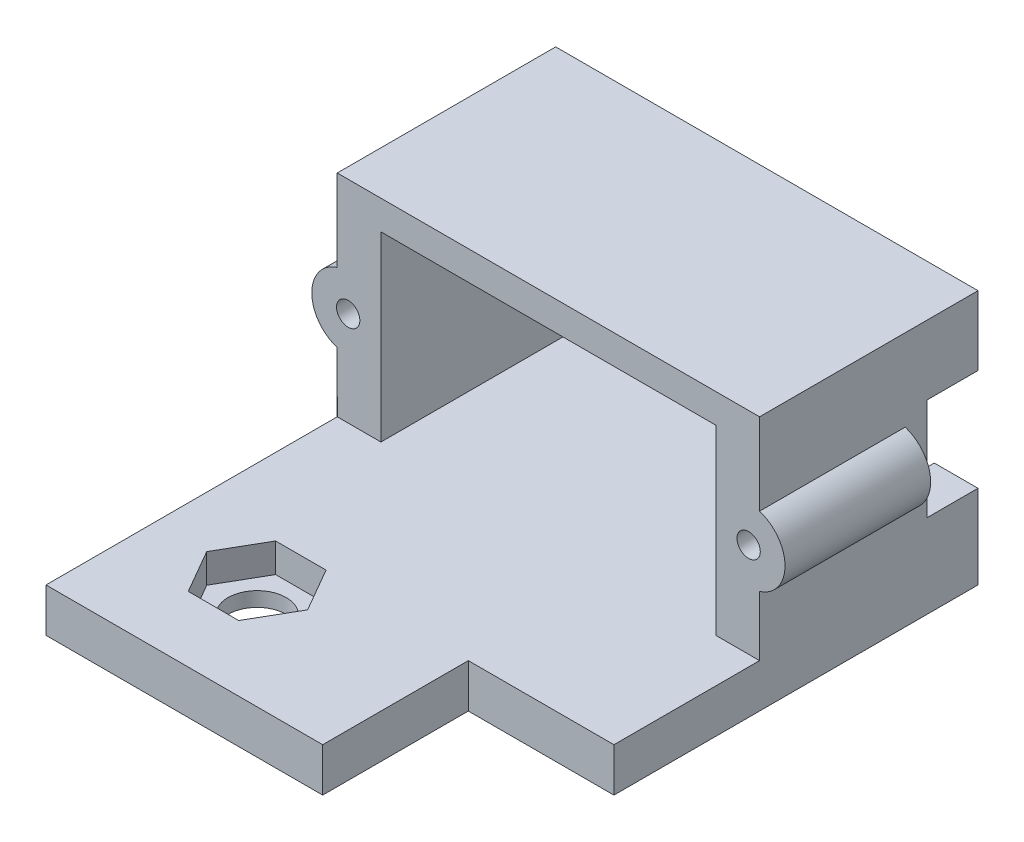
from build123d import *

# Parameters (mm, degrees)
SKETCH1_W                           = 23
SKETCH1_H                           = 15
BOSS_EXTRUDE1_DEPTH                 = 3
BOSS_EXTRUDE2_DEPTH                 = 12.5
BOSS_EXTRUDE2_DEPTH_BACK            = 3
SKETCH2_W                           = 3
SKETCH2_H                           = 15
BOSS_EXTRUDE3_DEPTH                 = 10
TAP_START                           = -2.5
TAP_DRILL_FOR_M2X0_4_TAP1_OUTLINE_R = 0.8
TAP_DRILL_FOR_M2X0_4_TAP1_DEPTH     = 10
SKETCH6_W                           = 29
SKETCH6_H                           = 20
BOSS_EXTRUDE4_DEPTH                 = 3
SKETCH7_W                           = 10
SKETCH7_H                           = 10
CUT_EXTRUDE1_DEPTH                  = 35.301056835
CUT_EXTRUDE2_DEPTH                  = 2
F_4_0_4_DIAMETER_HOLE1_D            = 4
F_4_0_4_DIAMETER_HOLE1_DEPTH        = 10
F_4_0_4_DIAMETER_HOLE1_TIP          = 1.201721238
SKETCH12_W                          = 29
SKETCH12_H                          = 15
BOSS_EXTRUDE5_DEPTH                 = 2
SKETCH13_W                          = 3
SKETCH13_H                          = 7
CUT_EXTRUDE4_DEPTH                  = 3.5


# Read off the part's stored shape, not the designer's step: Tap Drill for M2x0.4 Tap1
with BuildPart() as part:
    # Sketch1 → Boss-Extrude1 (new body)
    with BuildSketch(Plane(origin=(0, 0, 0), x_dir=(1, 0, 0), z_dir=(0, 1, 0))):
        Rectangle(SKETCH1_W, SKETCH1_H)
    extrude(amount=BOSS_EXTRUDE1_DEPTH)

    # Sketch2 → Boss-Extrude2 (add, two sides: drawn at the far end of the back side and taken through both)
    with BuildSketch(Plane(origin=(0, 3, 0), x_dir=(1, 0, 0), z_dir=(0, 1, 0)).offset(-BOSS_EXTRUDE2_DEPTH_BACK)):
        with Locations((13, 0)):
            Rectangle(SKETCH2_W, SKETCH2_H)
        with Locations((-13, 0)):
            Rectangle(SKETCH2_W, SKETCH2_H)
    extrude(amount=BOSS_EXTRUDE2_DEPTH + BOSS_EXTRUDE2_DEPTH_BACK)

    # Sketch3 → Boss-Extrude3 (add)
    with BuildSketch(Plane.XY.offset(7.5)):
        with BuildLine():
            ThreePointArc((16.25, 9.5), (15.765564437, 10.979019946), (14.5, 11.884848004))
            Line((14.5, 11.884848004), (14.5, 7.115151996))
            ThreePointArc((14.5, 7.115151996), (15.765564437, 8.020980054), (16.25, 9.5))
        make_face()
        with BuildLine():
            Line((-14.5, 7.115151996), (-14.5, 11.884848004))
            ThreePointArc((-14.5, 11.884848004), (-16.25, 9.5), (-14.5, 7.115151996))
        make_face()
    extrude(amount=-BOSS_EXTRUDE3_DEPTH)

    # Tap Drill for M2x0.4 Tap1 outline → Tap Drill for M2x0.4 Tap1 (cut)
    with BuildSketch(Plane.XY.offset(TAP_START)):
        with Locations((-13.75, 9.5)):
            Circle(TAP_DRILL_FOR_M2X0_4_TAP1_OUTLINE_R)
    extrude(amount=TAP_DRILL_FOR_M2X0_4_TAP1_DEPTH, mode=Mode.SUBTRACT)

    # Tap Drill for M2x0.4 Tap1 2 outline → Tap Drill for M2x0.4 Tap1 2 (revolve, cut)
    with BuildSketch(Plane(origin=(13.75, 9.5, 0), x_dir=(1, 0, 0), z_dir=(0, -1, 0))):
        Polygon((0, 7.5), (0, -2.980688495), (0.800001695, -2.499998981), (0.8, 7.5), align=None)
    revolve(axis=Axis((13.75, 9.5, 0), (0, 0, 1)), mode=Mode.SUBTRACT)

    # Sketch6 → Boss-Extrude4 (add)
    with BuildSketch(Plane.XZ):
        with Locations((0, 17.5)):
            Rectangle(SKETCH6_W, SKETCH6_H)
    extrude(amount=-BOSS_EXTRUDE4_DEPTH)

    # Sketch7 → Cut-Extrude1 (cut, through all)
    with BuildSketch(Plane(origin=(0, 3, 0), x_dir=(1, 0, 0), z_dir=(0, 1, 0))):
        with Locations((9.5, -22.5)):
            Rectangle(SKETCH7_W, SKETCH7_H)
    extrude(amount=-CUT_EXTRUDE1_DEPTH, mode=Mode.SUBTRACT)

    # Sketch8 → Cut-Extrude2 (cut)
    with BuildSketch(Plane.XZ.offset(-3)):
        Polygon((-5.767949192, 17), (-4.035898385, 20), (-5.767949192, 23), (-9.232050808, 23), (-10.964101615, 20), (-9.232050808, 17), align=None)
    extrude(amount=CUT_EXTRUDE2_DEPTH, mode=Mode.SUBTRACT)

    # Ø4.0 (4) Diameter Hole1
    with Locations(Plane(origin=(0, 0, 0), x_dir=(-1, 0, 0), z_dir=(0, -1, 0))):
        with Locations((7.5, -20)):
            Hole(F_4_0_4_DIAMETER_HOLE1_D / 2, depth=F_4_0_4_DIAMETER_HOLE1_DEPTH)
            with Locations((0, 0, -(F_4_0_4_DIAMETER_HOLE1_DEPTH + F_4_0_4_DIAMETER_HOLE1_TIP / 2))):  # 118° drill point
                Cone(0, F_4_0_4_DIAMETER_HOLE1_D / 2, F_4_0_4_DIAMETER_HOLE1_TIP, mode=Mode.SUBTRACT)

    # Sketch12 → Boss-Extrude5 (add)
    with BuildSketch(Plane(origin=(0, 15.5, 0), x_dir=(1, 0, 0), z_dir=(0, 1, 0))):
        Rectangle(SKETCH12_W, SKETCH12_H)
    extrude(amount=BOSS_EXTRUDE5_DEPTH)

    # Sketch13 → Cut-Extrude4 (cut)
    with BuildSketch(Plane(origin=(0, 0, -7.5), x_dir=(-1, 0, 0), z_dir=(0, 0, -1))):
        with Locations((-13, 9.25)):
            Rectangle(SKETCH13_W, SKETCH13_H)
    extrude(amount=-CUT_EXTRUDE4_DEPTH, mode=Mode.SUBTRACT)


solid = part.part
